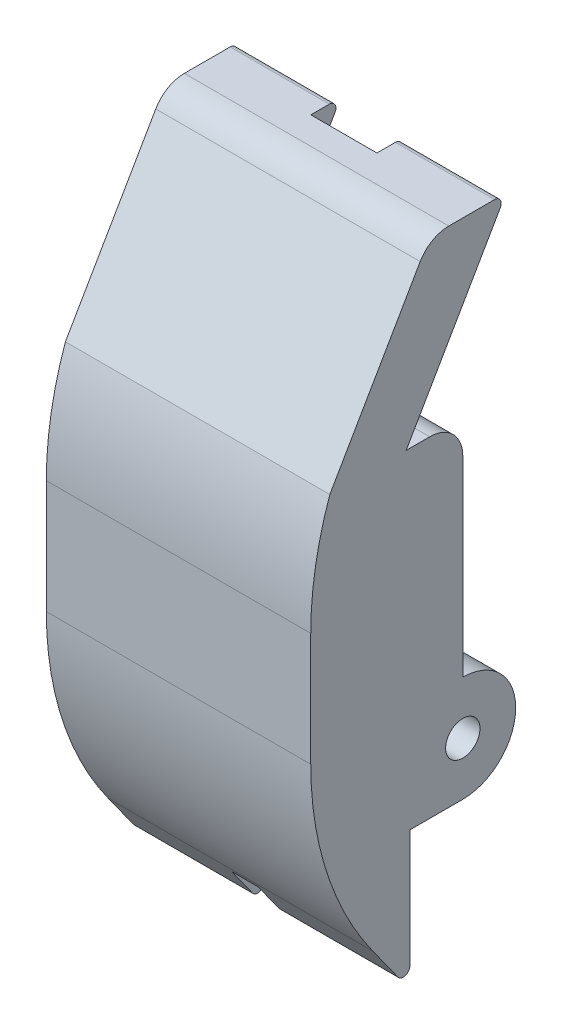
from build123d import *

# Parameters (mm, degrees)
BOSS_EXTRUDE5_DEPTH      = 20
BOSS_EXTRUDE5_DEPTH_BACK = 20
SKETCH6_R                = 2.6000000000000005
SKETCH7_W                = 30.000000000000004
SKETCH7_H                = 21
CUT_EXTRUDE1_DEPTH       = 16
BOSS_EXTRUDE6_DEPTH      = 18
BOSS_EXTRUDE7_DEPTH      = 4
SKETCH12_W               = 4.9999999999999964
SKETCH12_H               = 12.999999999999998
BOSS_EXTRUDE8_DEPTH      = 34
FILLET4_R                = 5
FILLET5_R                = 1
CUT_EXTRUDE3_START       = -15
CUT_EXTRUDE3_DEPTH       = 10
CUT_EXTRUDE4_DEPTH       = 3.923095079
FILLET7_R                = 5
FILLET8_R                = 50


with BuildPart() as part:
    # Sketch6 → Boss-Extrude5 (new, two sides: drawn at the far end of the back side and taken through both)
    with BuildSketch(Plane(origin=(0, 0, 0), x_dir=(0, 0, -1), z_dir=(1, 0, 0)).offset(-BOSS_EXTRUDE5_DEPTH_BACK)):
        with BuildLine():
            Line((-23, -8), (0, -8))
            ThreePointArc((0, -8), (8, 0), (0, 8))
            Line((0, 8), (-13, 7.999999999999998))
            Line((-13, 7.999999999999998), (-13, 42))
            Line((-13, 42), (-8.56466921236316, 42))
            Line((-8.56466921236316, 42), (6.542901083469773, 68.16707933130117))
            Line((6.542901083469773, 68.16707933130117), (-5.004104300322731, 68.16707933130117))
            Line((-5.004104300322731, 68.16707933130117), (-20.111674596155662, 42))
            Line((-20.111674596155662, 42), (-23, 42))
            Line((-23, 42), (-23, -8))
        make_face()
        Circle(SKETCH6_R, mode=Mode.SUBTRACT)
    extrude(amount=BOSS_EXTRUDE5_DEPTH + BOSS_EXTRUDE5_DEPTH_BACK)

    # Sketch7 → Cut-Extrude1 (cut)
    with BuildSketch(Plane(origin=(0, 8, 1.07e-15), x_dir=(1, 0, 0), z_dir=(0, 1, 0))):
        with Locations((0, -2.4999999999999982)):
            Rectangle(SKETCH7_W, SKETCH7_H)
    extrude(amount=-CUT_EXTRUDE1_DEPTH, mode=Mode.SUBTRACT)

    # Sketch9 → Boss-Extrude6 (add)
    with BuildSketch(Plane(origin=(20, 0, 0), x_dir=(0, 0, -1), z_dir=(1, 0, 0))):
        Polygon((-8, -8), (-7.9999999999999964, -28.890618944469697), (-23, -8), align=None)
    boss_extrude6 = extrude(amount=-BOSS_EXTRUDE6_DEPTH)

    # Mirror1: Boss-Extrude6 across plane
    add(boss_extrude6.mirror(Plane(origin=(0, 0, 0), x_dir=(0, 0, 1), z_dir=(1, 0, 0))))

    # Sketch10 → Boss-Extrude7 (add)
    with BuildSketch(Plane.ZY.offset(-2)):
        Polygon((23, -8), (13, -8), (13.000000000000004, -21.927079296313124), align=None)
    extrude(amount=BOSS_EXTRUDE7_DEPTH)

    # Sketch12 → Boss-Extrude8 (add)
    with BuildSketch(Plane(origin=(0, 8, 1.07e-15), x_dir=(1, 0, 0), z_dir=(0, 1, 1.3e-16))):
        with Locations((17.5, -6.499999999999999)):
            Rectangle(SKETCH12_W, SKETCH12_H)
    boss_extrude8 = extrude(amount=BOSS_EXTRUDE8_DEPTH)

    # Mirror2: Boss-Extrude8 across plane
    add(boss_extrude8.mirror(Plane(origin=(0, 0, 0), x_dir=(0, 0, 1), z_dir=(1, 0, 0))))

    # Fillet4
    fillet4_edges = [part.edges().sort_by_distance(p)[0] for p in [
        (2, -8, 10.5),
        (-2, -8, 10.5),
    ]]
    fillet(fillet4_edges, radius=FILLET4_R)

    # Fillet5
    fillet5_edges = [part.edges().sort_by_distance(p)[0] for p in [
        (0, 68.16707933130117, -6.542901083469773),
        (11, -28.890618944469697, 7.9999999999999964),
        (-11, -28.890618944469697, 7.9999999999999964),
    ]]
    fillet(fillet5_edges, radius=FILLET5_R)

    # Sketch13 → Cut-Extrude3 (cut)
    with BuildSketch(Plane(origin=(20, 0, 0), x_dir=(0, 0, -1), z_dir=(1, 0, 0)).offset(CUT_EXTRUDE3_START)):
        Polygon((6.542901083469864, 68.16707933130117), (-8.56466921236316, 42), (-13.094669212363161, 42), (2.0129010834698517, 68.16707933130117), align=None)
    extrude(amount=-CUT_EXTRUDE3_DEPTH, mode=Mode.SUBTRACT)

    # Sketch14 → Cut-Extrude4 (cut)
    with BuildSketch(Plane(origin=(0, 14.20861055645838, 24.61003538874555), x_dir=(-1, 0, 0), z_dir=(0, -0.49999999999999784, -0.8660254037844399))):
        Polygon((-15.000000000000004, 32.090732352764924), (-5.000000000000001, 48.794944027775955), (-5.000000000000001, 32.090732352764924), (-5.000000000000001, 29.87306695894652), (-15.000000000000007, 29.87306695894652), align=None)
    cut_extrude4 = extrude(amount=-CUT_EXTRUDE4_DEPTH, mode=Mode.SUBTRACT)

    # Mirror3: Cut-Extrude4 across plane
    add(cut_extrude4.mirror(Plane(origin=(0, 0, 0), x_dir=(0, 0, 1), z_dir=(1, 0, 0))), mode=Mode.SUBTRACT)

    # Fillet7
    fillet7_edges = [part.edges().sort_by_distance(p)[0] for p in [
        (17.5, 42, 5.6e-15),
        (-17.5, 42, 5.6e-15),
        (0, 68.16707933130117, 5.004104300322731),
        (5.000000000000001, 57.44704543050219, 1.9113133747955424),
        (-5.000000000000001, 57.44704543050219, 1.9113133747955426),
    ]]
    fillet(fillet7_edges, radius=FILLET7_R)

    # Fillet8
    # the kernel refuses this fillet: 50 mm, written as the material it takes off along each edge
    with BuildSketch(Plane(origin=(61.869597916190855, 42, 23), x_dir=(0, 0, -1), z_dir=(-1, 0, 0))) as fillet8_piece_1:
        with BuildLine():
            CenterArc((50, 16.747839166469827), FILLET8_R, 180, 19.569909983271373)
            Line((0, 16.747839166469827), (-1, 16.747839166469827))
            Line((-1, 16.747839166469827), (-1, 0))
            Line((-1, 0), (0, -1))
            ThreePointArc((0, -1), (1.444162701922167, -1), (1.946091911921222, -0.33495678332939605))
            Line((1.946091911921222, -0.33495678332939605), (2.888325403844334, 0))
        make_face()
    extrude(amount=123.73919583238171, mode=Mode.SUBTRACT)
    with BuildSketch(Plane(origin=(-60.228570108654466, -8.000000000000004, 23), x_dir=(0, -0.812294131590468, -0.5832480122415225), z_dir=(1, 0, 0))) as fillet8_piece_2:
        with BuildLine():
            CenterArc((FILLET8_R * 0.321828560869, FILLET8_R), FILLET8_R, 234.32068370191269, 35.67931629808726)
            Line((-FILLET8_R * 0.261419451372, FILLET8_R * 0.18770586841), (-FILLET8_R * 0.273084411617, FILLET8_R * 0.171459985778))
            Line((-FILLET8_R * 0.273084411617, FILLET8_R * 0.171459985778), (-FILLET8_R * 0.00643657121738, -FILLET8_R * 0.02))
            Line((-FILLET8_R * 0.00643657121738, -FILLET8_R * 0.02), (FILLET8_R * 0.321828560869, -FILLET8_R * 0.02))
            Line((FILLET8_R * 0.321828560869, -FILLET8_R * 0.02), (FILLET8_R * 0.321828560869, 5e-16))
        make_face()
    extrude(amount=120.45714021730896, mode=Mode.SUBTRACT)


solid = part.part
